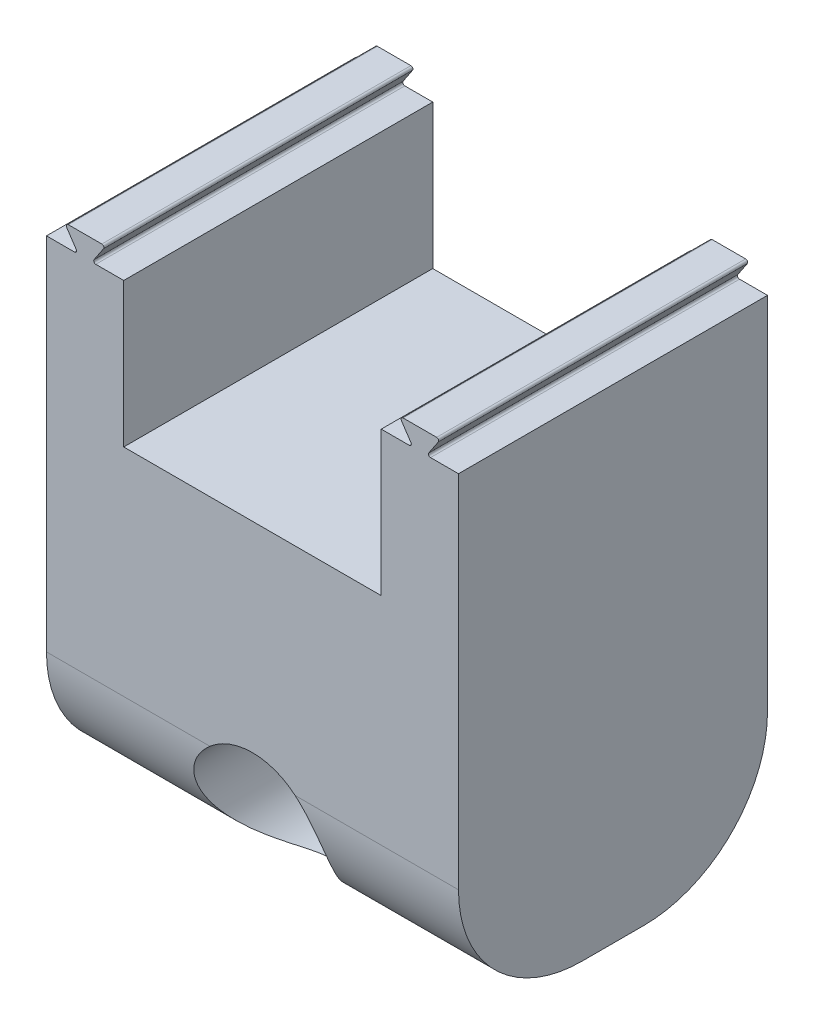
from build123d import *

# Parameters (mm, degrees)
SKETCH1_R           = 3.175
SKETCH1_W           = 12.5
SKETCH1_H           = 14
BOSS_EXTRUDE1_DEPTH = 15
SKETCH3_R           = 1.95
CUT_EXTRUDE2_DEPTH  = 7.5
BOSS_EXTRUDE2_DEPTH = 3.75
FILLET1_R           = 6
FILLET2_R           = 6
FILLET3_R           = 5
FILLET4_R           = 7.5
FILLET5_R           = 6
FILLET6_R           = 6
CUT_EXTRUDE4_DEPTH  = 20
SKETCH2_R           = 2.5
CUT_EXTRUDE1_DEPTH  = 10


with BuildPart() as part:
    # Sketch1 → Boss-Extrude1 (new body)
    with BuildSketch(Plane.XY):
        Polygon((60, -37.839734641), (55, -37.839734641), (45, -37.839734641), (40, -37.839734641), (40, -84.821135581), (60, -84.821135581), align=None)
        with Locations((50, -81.230435111)):
            Circle(SKETCH1_R, mode=Mode.SUBTRACT)
        with Locations((50, -61.330435111)):
            Rectangle(SKETCH1_W, SKETCH1_H, mode=Mode.SUBTRACT)
        with Locations((50, -41.430435111)):
            Circle(SKETCH1_R, mode=Mode.SUBTRACT)
    extrude(amount=BOSS_EXTRUDE1_DEPTH)

    # Sketch3 → Cut-Extrude2 (cut)
    with BuildSketch(Plane.XZ.offset(54.330435111)):
        with Locations(Location((50, 10, 0), (0, 0, 270))):
            Circle(SKETCH3_R)
    extrude(amount=-CUT_EXTRUDE2_DEPTH, mode=Mode.SUBTRACT)

    # Sketch6 → Boss-Extrude2 (add, symmetric)
    with BuildSketch(Plane.XY.offset(7.5)):
        Polygon((-46.25, -23.832633625), (46.25, -23.832633625), (53.75, -23.832633625), (53.75, -13.832633625), (-46.25, -13.832633625), align=None)
        Polygon((53.75, -23.832633625), (46.25, -23.832633625), (46.25, -37.839734641), (50, -37.839734641), (53.75, -37.839734641), align=None)
    extrude(amount=BOSS_EXTRUDE2_DEPTH, both=True)

    # Fillet1
    # the kernel refuses this fillet: 6 mm, written as the material it takes off along each edge
    with BuildSketch(Plane(origin=(75, -37.839734641, 0), x_dir=(0, 0, 1), z_dir=(-1, 0, 0))) as fillet1_piece_1_section:
        with BuildLine():
            CenterArc((FILLET1_R, -FILLET1_R), FILLET1_R, 90, 90)
            Line((0, -FILLET1_R), (0, 0))
            Line((0, 0), (FILLET1_R, 0))
        make_face()
    fillet1_piece_1 = extrude(amount=50, mode=Mode.PRIVATE)
    fillet1_piece_1 = split(fillet1_piece_1, bisect_by=Plane(origin=(53.75, -37.839734641, 0), z_dir=(1, 0, 0)), keep=Keep.TOP, mode=Mode.PRIVATE)
    fillet1_piece_1 = split(fillet1_piece_1, bisect_by=Plane(origin=(75, -37.839734641, 3.75), z_dir=(0, 0, 1)), keep=Keep.TOP, mode=Mode.PRIVATE)
    add(fillet1_piece_1, mode=Mode.SUBTRACT)
    with BuildSketch(Plane(origin=(75, -37.839734641, 0), x_dir=(0, 0, 1), z_dir=(-1, 0, 0))) as fillet1_piece_2_section:
        with BuildLine():
            CenterArc((FILLET1_R, -FILLET1_R), FILLET1_R, 90, 90)
            Line((0, -FILLET1_R), (0, 0))
            Line((0, 0), (FILLET1_R, 0))
        make_face()
    fillet1_piece_2 = extrude(amount=50, mode=Mode.PRIVATE)
    fillet1_piece_2 = split(fillet1_piece_2, bisect_by=Plane(origin=(53.75, -37.839734641, 0), z_dir=(1, 0, 0)), keep=Keep.TOP, mode=Mode.PRIVATE)
    fillet1_piece_2 = split(fillet1_piece_2, bisect_by=Plane(origin=(75, -37.839734641, 3.75), z_dir=(0, 0, -1)), keep=Keep.TOP, mode=Mode.PRIVATE)
    add(fillet1_piece_2, mode=Mode.SUBTRACT)
    with BuildSketch(Plane(origin=(75, -37.839734641, 0), x_dir=(0, 0, 1), z_dir=(-1, 0, 0))) as fillet1_piece_3_section:
        with BuildLine():
            CenterArc((FILLET1_R, -FILLET1_R), FILLET1_R, 90, 90)
            Line((0, -FILLET1_R), (0, 0))
            Line((0, 0), (FILLET1_R, 0))
        make_face()
    fillet1_piece_3 = extrude(amount=50, mode=Mode.PRIVATE)
    fillet1_piece_3 = split(fillet1_piece_3, bisect_by=Plane(origin=(53.75, -37.839734641, 0), z_dir=(-1, 0, 0)), keep=Keep.TOP, mode=Mode.PRIVATE)
    fillet1_piece_3 = split(fillet1_piece_3, bisect_by=Plane(origin=(46.25, -37.839734641, 0), z_dir=(1, 0, 0)), keep=Keep.TOP, mode=Mode.PRIVATE)
    fillet1_piece_3 = split(fillet1_piece_3, bisect_by=Plane(origin=(75, -37.839734641, 3.75), z_dir=(0, 0, -1)), keep=Keep.TOP, mode=Mode.PRIVATE)
    add(fillet1_piece_3, mode=Mode.SUBTRACT)
    with BuildSketch(Plane(origin=(75, -37.839734641, 0), x_dir=(0, 0, 1), z_dir=(-1, 0, 0))) as fillet1_piece_4_section:
        with BuildLine():
            CenterArc((FILLET1_R, -FILLET1_R), FILLET1_R, 90, 90)
            Line((0, -FILLET1_R), (0, 0))
            Line((0, 0), (FILLET1_R, 0))
        make_face()
    fillet1_piece_4 = extrude(amount=50, mode=Mode.PRIVATE)
    fillet1_piece_4 = split(fillet1_piece_4, bisect_by=Plane(origin=(46.25, -37.839734641, 0), z_dir=(-1, 0, 0)), keep=Keep.TOP, mode=Mode.PRIVATE)
    fillet1_piece_4 = split(fillet1_piece_4, bisect_by=Plane(origin=(75, -37.839734641, 3.75), z_dir=(0, 0, 1)), keep=Keep.TOP, mode=Mode.PRIVATE)
    add(fillet1_piece_4, mode=Mode.SUBTRACT)
    with BuildSketch(Plane(origin=(75, -37.839734641, 0), x_dir=(0, 0, 1), z_dir=(-1, 0, 0))) as fillet1_piece_5_section:
        with BuildLine():
            CenterArc((FILLET1_R, -FILLET1_R), FILLET1_R, 90, 90)
            Line((0, -FILLET1_R), (0, 0))
            Line((0, 0), (FILLET1_R, 0))
        make_face()
    fillet1_piece_5 = extrude(amount=50, mode=Mode.PRIVATE)
    fillet1_piece_5 = split(fillet1_piece_5, bisect_by=Plane(origin=(46.25, -37.839734641, 0), z_dir=(-1, 0, 0)), keep=Keep.TOP, mode=Mode.PRIVATE)
    fillet1_piece_5 = split(fillet1_piece_5, bisect_by=Plane(origin=(75, -37.839734641, 3.75), z_dir=(0, 0, -1)), keep=Keep.TOP, mode=Mode.PRIVATE)
    add(fillet1_piece_5, mode=Mode.SUBTRACT)
    with BuildSketch(Plane(origin=(25, -37.839734641, 15), x_dir=(0, 0, -1), z_dir=(1, 0, 0))) as fillet1_piece_6_section:
        with BuildLine():
            CenterArc((FILLET1_R, -FILLET1_R), FILLET1_R, 90, 90)
            Line((0, -FILLET1_R), (0, 0))
            Line((0, 0), (FILLET1_R, 0))
        make_face()
    fillet1_piece_6 = extrude(amount=50, mode=Mode.PRIVATE)
    fillet1_piece_6 = split(fillet1_piece_6, bisect_by=Plane(origin=(25, -37.839734641, 11.25), z_dir=(0, 0, -1)), keep=Keep.TOP, mode=Mode.PRIVATE)
    fillet1_piece_6 = split(fillet1_piece_6, bisect_by=Plane(origin=(46.25, -37.839734641, 15), z_dir=(-1, 0, 0)), keep=Keep.TOP, mode=Mode.PRIVATE)
    add(fillet1_piece_6, mode=Mode.SUBTRACT)
    with BuildSketch(Plane(origin=(25, -37.839734641, 15), x_dir=(0, 0, -1), z_dir=(1, 0, 0))) as fillet1_piece_7_section:
        with BuildLine():
            CenterArc((FILLET1_R, -FILLET1_R), FILLET1_R, 90, 90)
            Line((0, -FILLET1_R), (0, 0))
            Line((0, 0), (FILLET1_R, 0))
        make_face()
    fillet1_piece_7 = extrude(amount=50, mode=Mode.PRIVATE)
    fillet1_piece_7 = split(fillet1_piece_7, bisect_by=Plane(origin=(25, -37.839734641, 11.25), z_dir=(0, 0, 1)), keep=Keep.TOP, mode=Mode.PRIVATE)
    fillet1_piece_7 = split(fillet1_piece_7, bisect_by=Plane(origin=(46.25, -37.839734641, 15), z_dir=(-1, 0, 0)), keep=Keep.TOP, mode=Mode.PRIVATE)
    add(fillet1_piece_7, mode=Mode.SUBTRACT)
    with BuildSketch(Plane(origin=(25, -37.839734641, 15), x_dir=(0, 0, -1), z_dir=(1, 0, 0))) as fillet1_piece_8_section:
        with BuildLine():
            CenterArc((FILLET1_R, -FILLET1_R), FILLET1_R, 90, 90)
            Line((0, -FILLET1_R), (0, 0))
            Line((0, 0), (FILLET1_R, 0))
        make_face()
    fillet1_piece_8 = extrude(amount=50, mode=Mode.PRIVATE)
    fillet1_piece_8 = split(fillet1_piece_8, bisect_by=Plane(origin=(53.75, -37.839734641, 15), z_dir=(-1, 0, 0)), keep=Keep.TOP, mode=Mode.PRIVATE)
    fillet1_piece_8 = split(fillet1_piece_8, bisect_by=Plane(origin=(25, -37.839734641, 11.25), z_dir=(0, 0, 1)), keep=Keep.TOP, mode=Mode.PRIVATE)
    fillet1_piece_8 = split(fillet1_piece_8, bisect_by=Plane(origin=(46.25, -37.839734641, 15), z_dir=(1, 0, 0)), keep=Keep.TOP, mode=Mode.PRIVATE)
    add(fillet1_piece_8, mode=Mode.SUBTRACT)
    with BuildSketch(Plane(origin=(25, -37.839734641, 15), x_dir=(0, 0, -1), z_dir=(1, 0, 0))) as fillet1_piece_9_section:
        with BuildLine():
            CenterArc((FILLET1_R, -FILLET1_R), FILLET1_R, 90, 90)
            Line((0, -FILLET1_R), (0, 0))
            Line((0, 0), (FILLET1_R, 0))
        make_face()
    fillet1_piece_9 = extrude(amount=50, mode=Mode.PRIVATE)
    fillet1_piece_9 = split(fillet1_piece_9, bisect_by=Plane(origin=(53.75, -37.839734641, 15), z_dir=(1, 0, 0)), keep=Keep.TOP, mode=Mode.PRIVATE)
    fillet1_piece_9 = split(fillet1_piece_9, bisect_by=Plane(origin=(25, -37.839734641, 11.25), z_dir=(0, 0, -1)), keep=Keep.TOP, mode=Mode.PRIVATE)
    add(fillet1_piece_9, mode=Mode.SUBTRACT)
    with BuildSketch(Plane(origin=(25, -37.839734641, 15), x_dir=(0, 0, -1), z_dir=(1, 0, 0))) as fillet1_piece_10_section:
        with BuildLine():
            CenterArc((FILLET1_R, -FILLET1_R), FILLET1_R, 90, 90)
            Line((0, -FILLET1_R), (0, 0))
            Line((0, 0), (FILLET1_R, 0))
        make_face()
    fillet1_piece_10 = extrude(amount=50, mode=Mode.PRIVATE)
    fillet1_piece_10 = split(fillet1_piece_10, bisect_by=Plane(origin=(53.75, -37.839734641, 15), z_dir=(1, 0, 0)), keep=Keep.TOP, mode=Mode.PRIVATE)
    fillet1_piece_10 = split(fillet1_piece_10, bisect_by=Plane(origin=(25, -37.839734641, 11.25), z_dir=(0, 0, 1)), keep=Keep.TOP, mode=Mode.PRIVATE)
    add(fillet1_piece_10, mode=Mode.SUBTRACT)

    # Fillet2
    # the kernel refuses this fillet: 6 mm, written as the material it takes off along each edge
    with BuildSketch(Plane(origin=(25, -84.821135581, 0), x_dir=(0, 1, 0), z_dir=(1, 0, 0))) as fillet2_piece_1:
        with BuildLine():
            CenterArc((FILLET2_R, FILLET2_R), FILLET2_R, 180, 90)
            Line((0, FILLET2_R), (0, 0))
            Line((0, 0), (FILLET2_R, 0))
        make_face()
    extrude(amount=50, mode=Mode.SUBTRACT)
    with BuildSketch(Plane(origin=(25, -84.821135581, 15), x_dir=(0, 1, 0), z_dir=(1, 0, 0))) as fillet2_piece_2:
        with BuildLine():
            CenterArc((FILLET2_R, -FILLET2_R), FILLET2_R, 90, 90)
            Line((0, -FILLET2_R), (0, 0))
            Line((0, 0), (FILLET2_R, 0))
        make_face()
    extrude(amount=50, mode=Mode.SUBTRACT)

    # Fillet3
    fillet3_edges = [part.edges().sort_by_distance(p)[0] for p in [
        (3.75, -13.832633625, 3.75),
    ]]
    fillet(fillet3_edges, radius=FILLET3_R)

    # Fillet4
    # the kernel refuses this fillet: 7.5 mm, written as the material it takes off along each edge
    with BuildSketch(Plane(origin=(-63.92766953, -23.832633625, 3.75), x_dir=(0, 1, 0), z_dir=(1, 0, 0))) as fillet4_piece_1:
        with BuildLine():
            CenterArc((7.5, 7.071067812), FILLET4_R, 180, 70.528779366)
            Line((0, 7.071067812), (0, 0))
            Line((0, 0), (5, 0))
        make_face()
    extrude(amount=110.17766953, mode=Mode.SUBTRACT)

    # Fillet5
    # the kernel refuses this fillet: 6 mm, written as the material it adds along each edge
    with BuildSketch(Plane(origin=(53.75, -38.277585776, 11.25), x_dir=(0, 1, 0), z_dir=(-1, 0, 0))) as fillet5_piece_1_section:
        with BuildLine():
            CenterArc((3.152063664, -6), FILLET5_R, 90, 46.567463442)
            ThreePointArc((-1.205042601, -1.875), (-0.514692889, -0.993946388), (0, 0))
            Line((0, 0), (3.152063664, 0))
        make_face()
    fillet5_piece_1 = extrude(amount=11.255771566, mode=Mode.PRIVATE)
    fillet5_piece_1 = fillet5_piece_1 - Plane(origin=(50, -41.430435111, 11.25), x_dir=(1, 0, 0), z_dir=(0, 0, -1)) * Cylinder(3.175, 36, mode=Mode.PRIVATE)
    fillet5_piece_1 = split(fillet5_piece_1, bisect_by=Plane(origin=(46.25, -38.277585776, 11.25), z_dir=(1, 0, 0)), keep=Keep.TOP, mode=Mode.PRIVATE)
    add(fillet5_piece_1)
    with BuildSketch(Plane(origin=(57.505771566, -38.277585776, 11.25), x_dir=(0, -0.5406577313138206, 0.8412426627142685), z_dir=(-1, 0, 0))) as fillet5_piece_2_section:
        with BuildLine():
            CenterArc((3.343268387, 5.895596817), FILLET5_R, 212.728424697, 46.567463442)
            Line((-1.704187589, 2.651650429), (0, 0))
            ThreePointArc((0, 0), (1.114422796, 0.104403183), (2.228845591, 0))
        make_face()
    fillet5_piece_2 = extrude(amount=11.255771566, mode=Mode.PRIVATE)
    fillet5_piece_2 = fillet5_piece_2 - Plane(origin=(50, -41.430435111, 11.25), x_dir=(1, 0, 0), z_dir=(0, 0, -1)) * Cylinder(3.175, 34, mode=Mode.PRIVATE)
    fillet5_piece_2 = split(fillet5_piece_2, bisect_by=Plane(origin=(53.75, -38.277585776, 11.25), z_dir=(-1, 0, 0)), keep=Keep.TOP, mode=Mode.PRIVATE)
    add(fillet5_piece_2)

    # Fillet6
    # the kernel refuses this fillet: 6 mm, written as the material it adds along each edge
    with BuildSketch(Plane(origin=(46.25, -38.277585776, 3.75), x_dir=(0, 1, 0), z_dir=(1, 0, 0))) as fillet6_piece_1_section:
        with BuildLine():
            CenterArc((3.152063664, -6), FILLET6_R, 90, 46.567463442)
            ThreePointArc((-1.205042601, -1.875), (-0.514692889, -0.993946388), (0, 0))
            Line((0, 0), (3.152063664, 0))
        make_face()
    fillet6_piece_1 = extrude(amount=11.255771566, mode=Mode.PRIVATE)
    fillet6_piece_1 = split(fillet6_piece_1, bisect_by=Plane(origin=(53.75, -38.277585776, 3.75), z_dir=(-1, 0, 0)), keep=Keep.TOP, mode=Mode.PRIVATE)
    fillet6_piece_1 = fillet6_piece_1 - Plane(origin=(50, -41.430435111, 3.75), x_dir=(1, 0, 0), z_dir=(0, 0, -1)) * Cylinder(3.175, 36, mode=Mode.PRIVATE)
    add(fillet6_piece_1)
    with BuildSketch(Plane(origin=(42.494228434, -38.277585776, 3.75), x_dir=(0, 1, 0), z_dir=(1, 0, 0))) as fillet6_piece_2_section:
        with BuildLine():
            CenterArc((3.152063664, -6), FILLET6_R, 90, 46.567463442)
            ThreePointArc((-1.205042601, -1.875), (-0.514692889, -0.993946388), (0, 0))
            Line((0, 0), (3.152063664, 0))
        make_face()
    fillet6_piece_2 = extrude(amount=11.255771566, mode=Mode.PRIVATE)
    fillet6_piece_2 = split(fillet6_piece_2, bisect_by=Plane(origin=(46.25, -38.277585776, 3.75), z_dir=(1, 0, 0)), keep=Keep.TOP, mode=Mode.PRIVATE)
    fillet6_piece_2 = fillet6_piece_2 - Plane(origin=(50, -41.430435111, 3.75), x_dir=(1, 0, 0), z_dir=(0, 0, -1)) * Cylinder(3.175, 36, mode=Mode.PRIVATE)
    add(fillet6_piece_2)

    # Sketch7 → Cut-Extrude4 (cut)
    with BuildSketch(Plane.XY.offset(15)):
        with BuildLine():
            Line((42.687629738, -60.330435111), (41.062370262, -60.330435111))
            ThreePointArc((41.062370262, -60.330435111), (40.974148499, -60.383350925), (40.979293264, -60.486096699))
            Line((40.979293264, -60.486096699), (41.440706736, -61.174773522))
            ThreePointArc((41.440706736, -61.174773522), (41.445851501, -61.277519297), (41.357629738, -61.330435111))
            Line((41.357629738, -61.330435111), (-57.000451656, -61.330435111))
            Line((-57.000451656, -61.330435111), (-57.000451656, -7.955917112))
            Line((-57.000451656, -7.955917112), (60, -7.955917112))
            Line((60, -7.955917112), (60, -61.330435111))
            Line((60, -61.330435111), (58.642370262, -61.330435111))
            ThreePointArc((58.642370262, -61.330435111), (58.554148499, -61.277519297), (58.559293264, -61.174773522))
            Line((58.559293264, -61.174773522), (59.020706736, -60.486096699))
            ThreePointArc((59.020706736, -60.486096699), (59.025851501, -60.383350925), (58.937629738, -60.330435111))
            Line((58.937629738, -60.330435111), (57.312370262, -60.330435111))
            ThreePointArc((57.312370262, -60.330435111), (57.224148499, -60.383350925), (57.229293264, -60.486096699))
            Line((57.229293264, -60.486096699), (57.690706736, -61.174773522))
            ThreePointArc((57.690706736, -61.174773522), (57.695851501, -61.277519297), (57.607629738, -61.330435111))
            Line((57.607629738, -61.330435111), (42.392370262, -61.330435111))
            ThreePointArc((42.392370262, -61.330435111), (42.304148499, -61.277519297), (42.309293264, -61.174773522))
            Line((42.309293264, -61.174773522), (42.770706736, -60.486096699))
            ThreePointArc((42.770706736, -60.486096699), (42.775851501, -60.383350925), (42.687629738, -60.330435111))
        make_face()
    extrude(amount=-CUT_EXTRUDE4_DEPTH, mode=Mode.SUBTRACT)

    # Sketch2 → Cut-Extrude1 (cut)
    with BuildSketch(Plane.XZ.offset(40)):
        with Locations((40, 9.937454881)):
            Circle(SKETCH2_R)
    extrude(amount=-CUT_EXTRUDE1_DEPTH, mode=Mode.SUBTRACT)


solid = part.part
